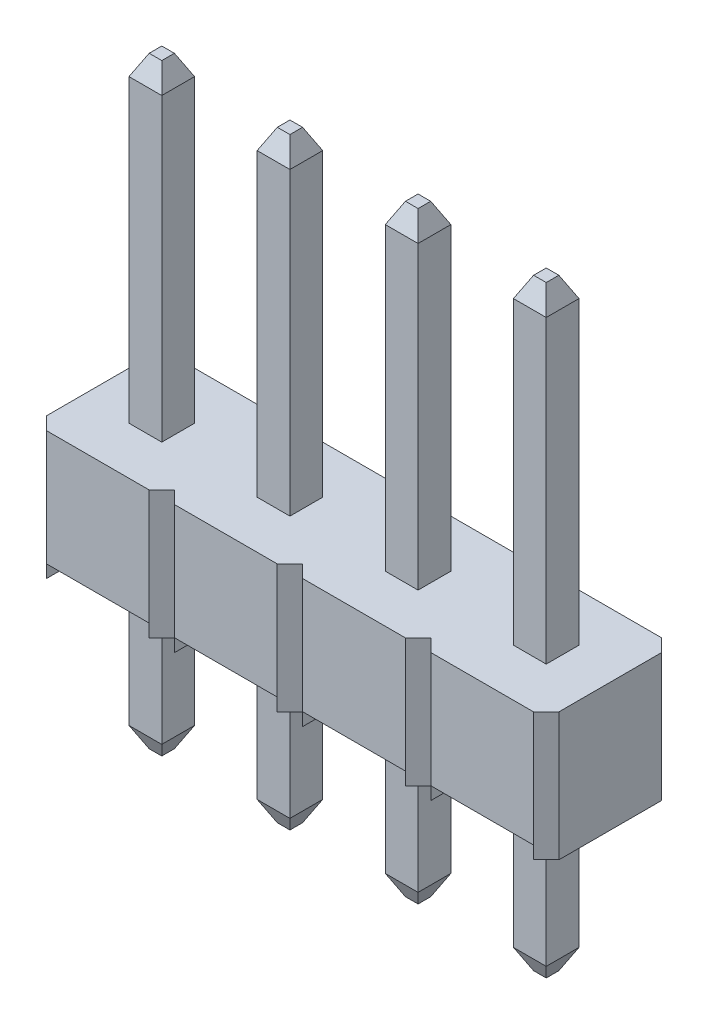
from build123d import *
from OCP.BRepFilletAPI import BRepFilletAPI_MakeChamfer

# Parameters (mm, degrees)
CUT_EXTRUDE1_START   = -2.54
CUT_EXTRUDE1_DEPTH   = 2.286
CUT_EXTRUDE1_START_2 = -0.254
CUT_EXTRUDE1_2_DEPTH = 0.254
SKETCH2_W            = 2.032
SKETCH2_H            = 2.54
CUT_EXTRUDE2_DEPTH   = 0.254
CUT_EXTRUDE3_DEPTH   = 0.254
CUT_EXTRUDE4_DEPTH   = 0.254
BOSS_EXTRUDE1_DEPTH  = 0.254
BOSS_EXTRUDE2_DEPTH  = 0.254
SKETCH7_W            = 0.65
SKETCH7_H            = 0.65
BOSS_EXTRUDE3_DEPTH  = 3.302
SKETCH8_W            = 0.65
SKETCH8_H            = 0.65
BOSS_EXTRUDE4_DEPTH  = 3.302
SKETCH9_W            = 0.65
SKETCH9_H            = 0.65
BOSS_EXTRUDE5_DEPTH  = 3.302
SKETCH10_W           = 0.65
SKETCH10_H           = 0.65
BOSS_EXTRUDE6_DEPTH  = 3.302
SKETCH11_W           = 0.65
SKETCH11_H           = 0.65
BOSS_EXTRUDE7_DEPTH  = 6.35
SKETCH12_W           = 0.65
SKETCH12_H           = 0.65
BOSS_EXTRUDE8_DEPTH  = 6.35
SKETCH13_W           = 0.65
SKETCH13_H           = 0.65
BOSS_EXTRUDE9_DEPTH  = 6.35
SKETCH14_W           = 0.65
SKETCH14_H           = 0.65
BOSS_EXTRUDE10_DEPTH = 6.35
CHAMFER1_SIZE        = 0.254
CHAMFER2_SIZE        = 0.2
CHAMFER2_SIZE2       = 0.4


with BuildPart() as part:
    # Cut-Extrude1: read off the stored shape, not the designer's step
    # Cut-Extrude1 outline → Cut-Extrude1 (new body)
    with BuildSketch(Plane.XZ.offset(CUT_EXTRUDE1_START)):
        Polygon((3.556, 1.27), (1.524, 1.27), (1.27, 1.016), (1.016, 1.27), (-1.016, 1.27), (-1.27, 1.016), (-1.27, -1.27), (1.016, -1.27), (1.27, -1.016), (1.524, -1.27), (3.556, -1.27), (3.81, -1.016), (4.064, -1.27), (6.096, -1.27), (6.35, -1.016), (6.604, -1.27), (8.636, -1.27), (8.89, -1.016), (8.89, 1.27), (6.604, 1.27), (6.35, 1.016), (6.096, 1.27), (4.064, 1.27), (3.81, 1.016), align=None)
    extrude(amount=CUT_EXTRUDE1_DEPTH)

    # Cut-Extrude1 2 outline → Cut-Extrude1 2 (add)
    with BuildSketch(Plane.XZ.offset(CUT_EXTRUDE1_START_2)):
        Polygon((1.27, -1.016), (1.524, -1.27), (1.524, 1.27), (1.27, 1.016), (1.016, 1.27), (-1.016, 1.27), (-1.27, 1.016), (-1.27, -1.27), (1.016, -1.27), align=None)
        Polygon((3.556, 1.27), (3.556, -1.27), (3.81, -1.016), (4.064, -1.27), (6.096, -1.27), (6.35, -1.016), (6.604, -1.27), (8.636, -1.27), (8.89, -1.016), (8.89, 1.27), (6.604, 1.27), (6.35, 1.016), (6.096, 1.27), (4.064, 1.27), (3.81, 1.016), align=None)
    extrude(amount=CUT_EXTRUDE1_2_DEPTH)

    # Sketch2 → Cut-Extrude2 (cut)
    with BuildSketch(Plane.XZ):
        with Locations((5.08, 0)):
            Rectangle(SKETCH2_W, SKETCH2_H)
    extrude(amount=-CUT_EXTRUDE2_DEPTH, mode=Mode.SUBTRACT)

    # Sketch3 → Cut-Extrude3 (cut)
    with BuildSketch(Plane.XZ):
        Polygon((-1.27, -1.27), (1.016, -1.27), (1.016, 1.27), (-1.016, 1.27), (-1.27, 1.016), align=None)
    extrude(amount=-CUT_EXTRUDE3_DEPTH, mode=Mode.SUBTRACT)

    # Sketch4 → Cut-Extrude4 (cut)
    with BuildSketch(Plane.XZ):
        Polygon((6.604, -1.27), (8.636, -1.27), (8.89, -1.016), (8.89, 1.27), (6.604, 1.27), align=None)
    extrude(amount=-CUT_EXTRUDE4_DEPTH, mode=Mode.SUBTRACT)

    # Sketch5 → Boss-Extrude1 (add)
    with BuildSketch(Plane.XZ.offset(-0.254)):
        Polygon((-1.27, -1.27), (-1.27, 1.016), (-1.016, 1.27), (-1.016, -1.27), align=None)
    extrude(amount=BOSS_EXTRUDE1_DEPTH)

    # Sketch6 → Boss-Extrude2 (add)
    with BuildSketch(Plane.XZ.offset(-0.254)):
        Polygon((8.89, 1.27), (8.89, -1.016), (8.636, -1.27), (8.636, 1.27), align=None)
    extrude(amount=BOSS_EXTRUDE2_DEPTH)

    # Sketch7 → Boss-Extrude3 (add)
    with BuildSketch(Plane.XZ.offset(-0.254)):
        Rectangle(SKETCH7_W, SKETCH7_H)
    extrude(amount=BOSS_EXTRUDE3_DEPTH)

    # Sketch8 → Boss-Extrude4 (add)
    with BuildSketch(Plane.XZ.offset(-0.254)):
        with Locations((2.54, 0)):
            Rectangle(SKETCH8_W, SKETCH8_H)
    extrude(amount=BOSS_EXTRUDE4_DEPTH)

    # Sketch9 → Boss-Extrude5 (add)
    with BuildSketch(Plane.XZ.offset(-0.254)):
        with Locations((5.08, 0)):
            Rectangle(SKETCH9_W, SKETCH9_H)
    extrude(amount=BOSS_EXTRUDE5_DEPTH)

    # Sketch10 → Boss-Extrude6 (add)
    with BuildSketch(Plane.XZ.offset(-0.254)):
        with Locations((7.62, 0)):
            Rectangle(SKETCH10_W, SKETCH10_H)
    extrude(amount=BOSS_EXTRUDE6_DEPTH)

    # Sketch11 → Boss-Extrude7 (add)
    with BuildSketch(Plane(origin=(0, 2.54, 0), x_dir=(-1, 0, 0), z_dir=(0, 1, 0))):
        Rectangle(SKETCH11_W, SKETCH11_H)
    extrude(amount=BOSS_EXTRUDE7_DEPTH)

    # Sketch12 → Boss-Extrude8 (add)
    with BuildSketch(Plane(origin=(0, 2.54, 0), x_dir=(-1, 0, 0), z_dir=(0, 1, 0))):
        with Locations((-2.54, 0)):
            Rectangle(SKETCH12_W, SKETCH12_H)
    extrude(amount=BOSS_EXTRUDE8_DEPTH)

    # Sketch13 → Boss-Extrude9 (add)
    with BuildSketch(Plane(origin=(0, 2.54, 0), x_dir=(-1, 0, 0), z_dir=(0, 1, 0))):
        with Locations((-5.08, 0)):
            Rectangle(SKETCH13_W, SKETCH13_H)
    extrude(amount=BOSS_EXTRUDE9_DEPTH)

    # Sketch14 → Boss-Extrude10 (add)
    with BuildSketch(Plane(origin=(0, 2.54, 0), x_dir=(-1, 0, 0), z_dir=(0, 1, 0))):
        with Locations((-7.62, 0)):
            Rectangle(SKETCH14_W, SKETCH14_H)
    extrude(amount=BOSS_EXTRUDE10_DEPTH)

    # Chamfer1
    chamfer1_edges = [part.edges().sort_by_distance(p)[0] for p in [
        (-1.27, 1.27, -1.27),
        (8.89, 1.27, 1.27),
    ]]
    chamfer(chamfer1_edges, length=CHAMFER1_SIZE)

    # Chamfer2: one chamfer whose edges measure the first distance from different faces: ONE call of the kernel's chamfer builder (chamfer() names one face for all edges)
    chamfer2_edges_1 = [part.edges().sort_by_distance(p)[0] for p in [
        (-0.325, -3.048, 0),
        (0, -3.048, -0.325),
        (0.325, -3.048, 0),
        (0, -3.048, 0.325),
    ]]
    chamfer2_side_1 = [part.faces().sort_by_distance(p)[0] for p in [
        (0, -3.048, 0),
    ]]
    chamfer2_edges_2 = [part.edges().sort_by_distance(p)[0] for p in [
        (2.54, -3.048, -0.325),
        (2.865, -3.048, 0),
        (2.54, -3.048, 0.325),
        (2.215, -3.048, 0),
    ]]
    chamfer2_side_2 = [part.faces().sort_by_distance(p)[0] for p in [
        (2.54, -3.048, 0),
    ]]
    chamfer2_edges_3 = [part.edges().sort_by_distance(p)[0] for p in [
        (5.08, -3.048, -0.325),
        (5.405, -3.048, 0),
        (5.08, -3.048, 0.325),
        (4.755, -3.048, 0),
    ]]
    chamfer2_side_3 = [part.faces().sort_by_distance(p)[0] for p in [
        (5.08, -3.048, 0),
    ]]
    chamfer2_edges_4 = [part.edges().sort_by_distance(p)[0] for p in [
        (7.62, -3.048, -0.325),
        (7.945, -3.048, 0),
        (7.62, -3.048, 0.325),
        (7.295, -3.048, 0),
    ]]
    chamfer2_side_4 = [part.faces().sort_by_distance(p)[0] for p in [
        (7.62, -3.048, 0),
    ]]
    chamfer2_edges_5 = [part.edges().sort_by_distance(p)[0] for p in [
        (0, 8.89, -0.325),
        (-0.325, 8.89, 0),
        (0, 8.89, 0.325),
        (0.325, 8.89, 0),
    ]]
    chamfer2_side_5 = [part.faces().sort_by_distance(p)[0] for p in [
        (0, 8.89, 0),
    ]]
    chamfer2_edges_6 = [part.edges().sort_by_distance(p)[0] for p in [
        (2.54, 8.89, -0.325),
        (2.215, 8.89, 0),
        (2.54, 8.89, 0.325),
        (2.865, 8.89, 0),
    ]]
    chamfer2_side_6 = [part.faces().sort_by_distance(p)[0] for p in [
        (2.54, 8.89, 0),
    ]]
    chamfer2_edges_7 = [part.edges().sort_by_distance(p)[0] for p in [
        (5.08, 8.89, -0.325),
        (4.755, 8.89, 0),
        (5.08, 8.89, 0.325),
        (5.405, 8.89, 0),
    ]]
    chamfer2_side_7 = [part.faces().sort_by_distance(p)[0] for p in [
        (5.08, 8.89, 0),
    ]]
    chamfer2_edges_8 = [part.edges().sort_by_distance(p)[0] for p in [
        (7.945, 8.89, 0),
        (7.62, 8.89, -0.325),
        (7.295, 8.89, 0),
        (7.62, 8.89, 0.325),
    ]]
    chamfer2_side_8 = [part.faces().sort_by_distance(p)[0] for p in [
        (7.62, 8.89, 0),
    ]]
    chamfer2 = BRepFilletAPI_MakeChamfer(part.part.solid().wrapped)
    for e in chamfer2_edges_1:
        chamfer2.Add(CHAMFER2_SIZE, CHAMFER2_SIZE2, e.wrapped, chamfer2_side_1[0].wrapped)  # the first distance lies on this face
    for e in chamfer2_edges_2:
        chamfer2.Add(CHAMFER2_SIZE, CHAMFER2_SIZE2, e.wrapped, chamfer2_side_2[0].wrapped)  # the first distance lies on this face
    for e in chamfer2_edges_3:
        chamfer2.Add(CHAMFER2_SIZE, CHAMFER2_SIZE2, e.wrapped, chamfer2_side_3[0].wrapped)  # the first distance lies on this face
    for e in chamfer2_edges_4:
        chamfer2.Add(CHAMFER2_SIZE, CHAMFER2_SIZE2, e.wrapped, chamfer2_side_4[0].wrapped)  # the first distance lies on this face
    for e in chamfer2_edges_5:
        chamfer2.Add(CHAMFER2_SIZE, CHAMFER2_SIZE2, e.wrapped, chamfer2_side_5[0].wrapped)  # the first distance lies on this face
    for e in chamfer2_edges_6:
        chamfer2.Add(CHAMFER2_SIZE, CHAMFER2_SIZE2, e.wrapped, chamfer2_side_6[0].wrapped)  # the first distance lies on this face
    for e in chamfer2_edges_7:
        chamfer2.Add(CHAMFER2_SIZE, CHAMFER2_SIZE2, e.wrapped, chamfer2_side_7[0].wrapped)  # the first distance lies on this face
    for e in chamfer2_edges_8:
        chamfer2.Add(CHAMFER2_SIZE, CHAMFER2_SIZE2, e.wrapped, chamfer2_side_8[0].wrapped)  # the first distance lies on this face
    add(Compound.cast(chamfer2.Shape()), mode=Mode.REPLACE)


solid = part.part
